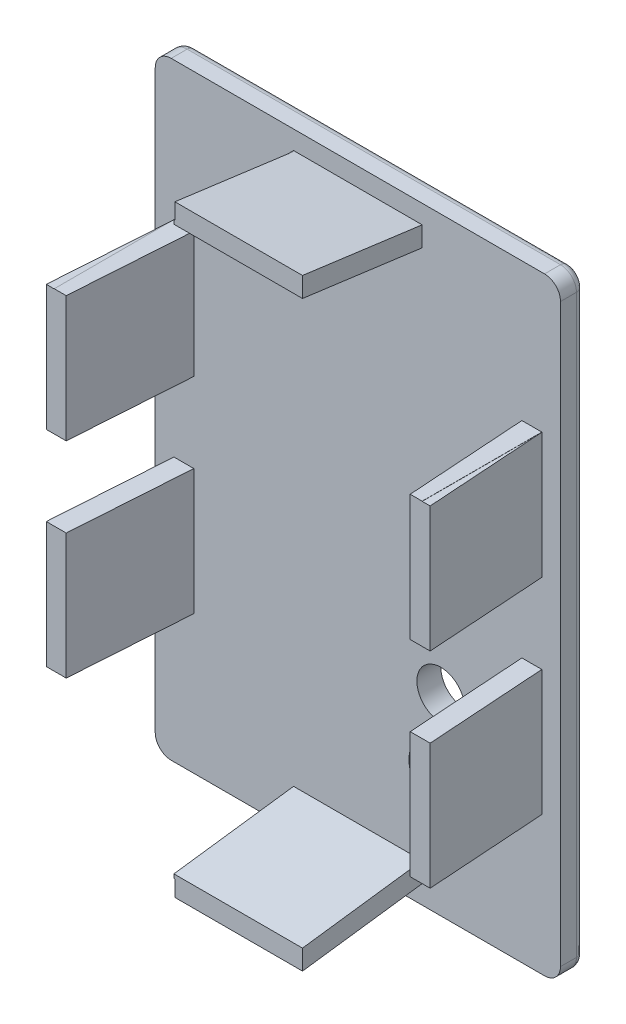
from build123d import *

# Parameters (mm, degrees)
CROQUIS1_W              = 50.8
CROQUIS1_H              = 76.2
SALIENTE_EXTRUIR1_DEPTH = 18
CROQUIS2_W              = 50.8
CROQUIS2_H              = 76.2
CROQUIS2_W_2            = 46.12
CROQUIS2_H_2            = 71.52
CROQUIS2_W_3            = 38.8
CROQUIS2_H_3            = 64.2
CORTAR_EXTRUIR1_DEPTH   = 15
CORTAR_EXTRUIR8_DEPTH   = 15
SALIENTE_EXTRUIR3_DEPTH = 41.5
CORTAR_EXTRUIR9_DEPTH   = 51.5
CORTAR_EXTRUIR10_DEPTH  = 51.5
SALIENTE_EXTRUIR4_DEPTH = 16
CORTAR_EXTRUIR11_DEPTH  = 16.5
REDONDEO3_R             = 2
REDONDEO4_R             = 1
CROQUIS15_W             = 48.12
CROQUIS15_H             = 10
CORTAR_EXTRUIR12_DEPTH  = 15
CROQUIS16_W             = 8
CROQUIS16_H             = 1.5
CORTAR_EXTRUIR13_DEPTH  = 2
CROQUIS17_R             = 4
CROQUIS17_R_2           = 3
CORTAR_EXTRUIR14_DEPTH  = 10


with BuildPart() as part:
    # Croquis1 → Saliente-Extruir1 (new body)
    with BuildSketch(Plane.XY):
        Rectangle(CROQUIS1_W, CROQUIS1_H)
    extrude(amount=SALIENTE_EXTRUIR1_DEPTH)

    # Croquis2 → Cortar-Extruir1 (cut)
    # profile 1 of 2: a face of its own
    with BuildSketch(Plane.XY.offset(18)):
        Rectangle(CROQUIS2_W, CROQUIS2_H)
        Rectangle(CROQUIS2_W_2, CROQUIS2_H_2, mode=Mode.SUBTRACT)
    # profile 2 of 2: a face of its own
    with BuildSketch(Plane.XY.offset(18)):
        Rectangle(CROQUIS2_W_3, CROQUIS2_H_3)
    extrude(amount=-CORTAR_EXTRUIR1_DEPTH, mode=Mode.SUBTRACT)

    # Croquis6 → Cortar-Extruir8 (cut)
    with BuildSketch(Plane.XY.offset(18)):
        Polygon((-23.06, 35.76), (-8.06, 35.76), (-8.06, 32.1), (-19.4, 32.1), (-19.4, 20.76), (-23.06, 20.76), align=None)
        Polygon((23.06, 35.76), (8.06, 35.76), (8.06, 32.1), (19.4, 32.1), (19.4, 20.76), (23.06, 20.76), align=None)
        Polygon((-23.06, -35.76), (-23.06, -20.76), (-19.4, -20.76), (-19.4, -32.1), (-8.06, -32.1), (-8.06, -35.76), align=None)
        Polygon((23.06, -35.76), (8.06, -35.76), (8.06, -32.1), (19.4, -32.1), (19.4, -20.76), (23.06, -20.76), align=None)
    extrude(amount=-CORTAR_EXTRUIR8_DEPTH, mode=Mode.SUBTRACT)

    # Croquis10 → Saliente-Extruir3 (add)
    with BuildSketch(Plane(origin=(0, -20.76, 0), x_dir=(-1, 0, 0), z_dir=(0, -1, 0))):
        Polygon((23.06, -18), (24.06, -18), (23.06, -3), align=None)
        Polygon((-23.06, -18), (-24.06, -18), (-23.06, -3), align=None)
    extrude(amount=-SALIENTE_EXTRUIR3_DEPTH)

    # Croquis11 → Cortar-Extruir9 (cut)
    with BuildSketch(Plane.XZ.offset(20.76)):
        Polygon((-19.4, 18), (-21.56, 18), (-20.56, 3), (-19.4, 3), align=None)
    extrude(amount=-CORTAR_EXTRUIR9_DEPTH, mode=Mode.SUBTRACT)

    # Croquis12 → Cortar-Extruir10 (cut)
    with BuildSketch(Plane.XZ.offset(20.76)):
        Polygon((19.4, 18), (19.4, 3), (20.56, 3), (21.56, 18), align=None)
    extrude(amount=-CORTAR_EXTRUIR10_DEPTH, mode=Mode.SUBTRACT)

    # Croquis13 → Saliente-Extruir4 (add)
    with BuildSketch(Plane(origin=(8.06, 0, 0), x_dir=(0, 0, -1), z_dir=(1, 0, 0))):
        Polygon((-18, -35.76), (-18, -37.76), (-3, -35.76), align=None)
        Polygon((-18, 35.76), (-18, 37.76), (-3, 35.76), align=None)
    extrude(amount=-SALIENTE_EXTRUIR4_DEPTH)

    # Croquis14 → Cortar-Extruir11 (cut)
    with BuildSketch(Plane(origin=(8.06, 0, 0), x_dir=(0, 0, -1), z_dir=(1, 0, 0))):
        Polygon((-3, -32.1), (-18, -32.1), (-18, -35.26), (-3, -33.26), align=None)
        Polygon((-18, 32.1), (-18, 35.26), (-3, 33.26), (-3, 32.1), align=None)
    extrude(amount=-CORTAR_EXTRUIR11_DEPTH, mode=Mode.SUBTRACT)

    # Redondeo3
    redondeo3_edges = [part.edges().sort_by_distance(p)[0] for p in [
        (25.4, 38.1, 1.5),
        (-25.4, 38.1, 1.5),
        (-25.4, -38.1, 1.5),
        (25.4, -38.1, 1.5),
    ]]
    fillet(redondeo3_edges, radius=REDONDEO3_R)

    # Redondeo4
    redondeo4_edges = [part.edges().sort_by_distance(p)[0] for p in [
        (-24.814213562, 37.514213562, 0),
        (-25.4, 0, 0),
        (-24.814213562, -37.514213562, 0),
        (0, -38.1, 0),
        (24.814213562, -37.514213562, 0),
        (25.4, 0, 0),
        (24.814213562, 37.514213562, 0),
        (0, 38.1, 0),
    ]]
    fillet(redondeo4_edges, radius=REDONDEO4_R)

    # Croquis15 → Cortar-Extruir12 (cut)
    with BuildSketch(Plane.XY.offset(18)):
        with Locations((0, -0.01)):
            Rectangle(CROQUIS15_W, CROQUIS15_H)
    extrude(amount=-CORTAR_EXTRUIR12_DEPTH, mode=Mode.SUBTRACT)

    # Croquis16 → Cortar-Extruir13 (cut)
    with BuildSketch(Plane.XZ.offset(38.1)):
        with Locations((0, 2.25)):
            Rectangle(CROQUIS16_W, CROQUIS16_H)
    extrude(amount=-CORTAR_EXTRUIR13_DEPTH, mode=Mode.SUBTRACT)

    # Croquis17 → Cortar-Extruir14 (cut)
    with BuildSketch(Plane.XY.offset(3)):
        with Locations((10.4, -23.1)):
            Circle(CROQUIS17_R)
        with Locations((10.4, -14.1)):
            Circle(CROQUIS17_R_2)
    extrude(amount=-CORTAR_EXTRUIR14_DEPTH, mode=Mode.SUBTRACT)


solid = part.part
